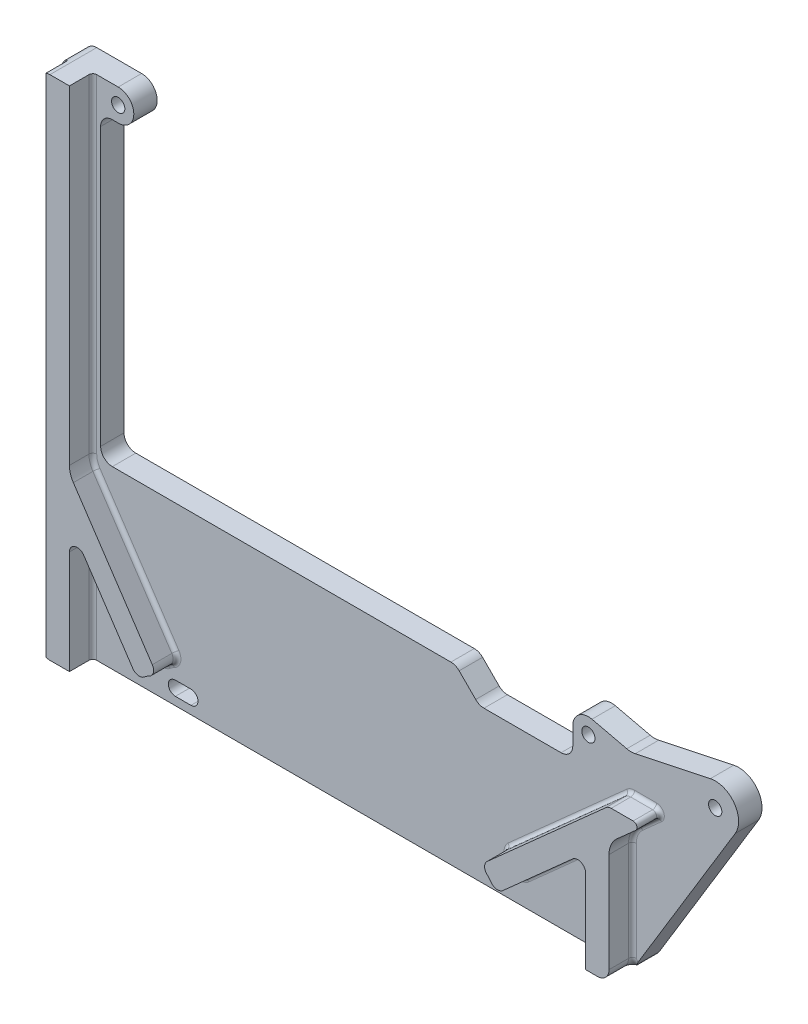
from build123d import *

# Parameters (mm, degrees)
SKETCH1_R           = 1.7
BOSS_EXTRUDE1_DEPTH = 6
BOSS_EXTRUDE2_START = 6
BOSS_EXTRUDE2_DEPTH = 6
SKETCH2_R           = 3.1
CUT_EXTRUDE1_DEPTH  = 3
FILLET1_R           = 2
FILLET2_R           = 6
FILLET3_R           = 1
FILLET4_R           = 1
FILLET5_DEPTH       = 6
FILLET5_START       = -1
FILLET5_3_DEPTH     = 13
FILLET5_START_2     = 6.9999999
FILLET5_4_DEPTH     = 5.0000001
FILLET5_5_DEPTH     = 6


with BuildPart() as part:
    # Sketch1 → Boss-Extrude1 (new body)
    with BuildSketch(Plane.XY):
        with BuildLine():
            Line((4, 0), (150.292108611, 0))
            Line((150.292108611, 0), (176.628985356, 43.386559906))
            ThreePointArc((176.628985356, 43.386559906), (176.393105018, 49.97239446), (170.254392606, 52.369281235))
            Line((170.254392606, 52.369281235), (151.015607145, 48.286332665))
            ThreePointArc((151.015607145, 48.286332665), (149.926554244, 48.177660945), (148.839947189, 48.308545892))
            Line((148.839947189, 48.308545892), (139.910123035, 50.395083576))
            ThreePointArc((139.910123035, 50.395083576), (136.514088914, 49.633727185), (135, 46.5))
            Line((135, 46.5), (135, 39))
            Line((135, 39), (111, 39))
            Line((111, 39), (105, 45))
            Line((105, 45), (14, 45))
            Line((14, 45), (14, 122))
            Line((14, 122), (18.5, 122))
            ThreePointArc((18.5, 122), (22.5, 126), (18.5, 130))
            Line((18.5, 130), (4, 130))
            Line((4, 130), (4, 0))
        make_face()
        with BuildLine():
            Line((33.15, 5.69), (37.15, 5.69))
            ThreePointArc((37.15, 5.69), (38.95, 3.89), (37.15, 2.09))
            Line((37.15, 2.09), (33.15, 2.09))
            ThreePointArc((33.15, 2.09), (31.35, 3.89), (33.15, 5.69))
        make_face(mode=Mode.SUBTRACT)
        with Locations((115.15, 3.89)):
            Circle(SKETCH1_R, mode=Mode.SUBTRACT)
        with Locations((171.5, 46.5)):
            Circle(SKETCH1_R, mode=Mode.SUBTRACT)
        with Locations((18.5, 126)):
            Circle(SKETCH1_R, mode=Mode.SUBTRACT)
        with Locations((139, 46.5)):
            Circle(SKETCH1_R, mode=Mode.SUBTRACT)
    extrude(amount=BOSS_EXTRUDE1_DEPTH)

    # Sketch1<3> → Boss-Extrude2 (add)
    with BuildSketch(Plane.XY.offset(BOSS_EXTRUDE2_START)):
        with BuildLine():
            Line((12, 33.156912913), (29.769570295, 6.545367431))
            ThreePointArc((29.769570295, 6.545367431), (31.818094908, 8.879830504), (34.759400799, 9.877272523))
            Line((34.759400799, 9.877272523), (12, 43.961542399))
            Line((12, 43.961542399), (12, 130))
            Line((12, 130), (6, 130))
            Line((6, 130), (6, 0))
            Line((6, 0), (12, 0))
            Line((12, 0), (12, 33.156912913))
        make_face()
        with BuildLine():
            ThreePointArc((117.028697802, 9.58828874), (119.626144393, 7.885513906), (121.024211708, 5.112144348))
            Line((121.024211708, 5.112144348), (144.292108611, 25.881627522))
            Line((144.292108611, 25.881627522), (144.292108611, 0))
            Line((144.292108611, 0), (150.292108611, 0))
            Line((150.292108611, 0), (150.292108611, 31.237371514))
            Line((150.292108611, 31.237371514), (159.087870064, 39.088679274))
            Line((159.087870064, 39.088679274), (150.077765021, 39.088679274))
            Line((150.077765021, 39.088679274), (117.028697802, 9.58828874))
        make_face()
    extrude(amount=BOSS_EXTRUDE2_DEPTH)

    # Sketch2 → Cut-Extrude1 (cut)
    with BuildSketch(Plane(origin=(0, 0, 0), x_dir=(-1, 0, 0), z_dir=(0, 0, -1))):
        with Locations((-139, 46.5)):
            Circle(SKETCH2_R)
    extrude(amount=-CUT_EXTRUDE1_DEPTH, mode=Mode.SUBTRACT)

    # Fillet1
    fillet1_edges = [part.edges().sort_by_distance(p)[0] for p in [
        (150.077765021, 39.088679274, 9),
        (117.028697802, 9.58828874, 9),
        (121.024211708, 5.112144348, 9),
        (144.292108611, 25.881627522, 9),
        (12, 33.156912913, 9),
        (29.769570295, 6.545367431, 9),
        (34.759400799, 9.877272523, 9),
    ]]
    fillet(fillet1_edges, radius=FILLET1_R)

    # Fillet2
    fillet2_edges = [part.edges().sort_by_distance(p)[0] for p in [
        (150.292108611, 31.237371514, 9),
        (12, 43.961542399, 9),
    ]]
    fillet(fillet2_edges, radius=FILLET2_R)

    # Fillet3
    fillet3_edges = [part.edges().sort_by_distance(p)[0] for p in [
        (159.087870064, 39.088679274, 9),
    ]]
    fillet(fillet3_edges, radius=FILLET3_R)

    # Fillet4
    fillet4_edges = [part.edges().sort_by_distance(p)[0] for p in [
        (150.292108611, 14.275239757, 6),
        (144.292108611, 10.70775043, 6),
        (31.818094908, 8.879830504, 6),
        (21.955332725, 18.24789794, 6),
        (132.014705022, 14.922522436, 6),
        (119.626144393, 7.885513906, 6),
        (134.291167915, 24.997183839, 6),
        (143.109520399, 23.24083315, 6),
        (13.419721476, 28.474156966, 6),
        (29.643487506, 7.953534135, 6),
        (33.507072774, 10.53340121, 6),
        (121.499193347, 6.443768461, 6),
        (118.405499352, 9.909610742, 6),
        (150.127840882, 38.957381532, 6),
        (23.123694308, 27.302799836, 6),
        (150.816111741, 31.002714877, 6),
        (12.258093391, 44.039791347, 6),
        (153.653220831, 39.088679274, 6),
        (154.714203524, 35.184639557, 6),
        (157.400244487, 38.445032985, 6),
        (12, 13.280094048, 6),
        (12, 87.89031346, 6),
        (6, 65, 6),
    ]]
    fillet(fillet4_edges, radius=FILLET4_R)

    # Fillet5: read off the stored shape, not the designer's step
    # Fillet5 outline → Fillet5 (add)
    with BuildSketch(Plane.XY):
        with BuildLine():
            ThreePointArc((135, 42), (134.121320344, 39.878679656), (132, 39))
            Line((132, 39), (135, 39))
            Line((135, 39), (135, 42))
        make_face()
        with BuildLine():
            ThreePointArc((112.242640687, 39), (111.09459039, 39.228361402), (110.121320344, 39.878679656))
            Line((110.121320344, 39.878679656), (111, 39))
            Line((111, 39), (112.242640687, 39))
        make_face()
    extrude(amount=FILLET5_DEPTH)

    # Fillet5 2 outline → Fillet5 2 (revolve, cut)
    with BuildSketch(Plane(origin=(151.292108611, 0, 7), x_dir=(1, 0, 0), z_dir=(0, 0, 1))):
        with BuildLine():
            ThreePointArc((4, 0), (1.878679656, 0.878679656), (1, 3))
            Line((1, 3), (1, 0))
            Line((1, 0), (4, 0))
        make_face()
    revolve(axis=Axis((151.292108611, 0, 7), (0, 1, 0)), mode=Mode.SUBTRACT)

    # Fillet5 3 outline → Fillet5 3 (cut)
    with BuildSketch(Plane.XY.offset(FILLET5_START)):
        with BuildLine():
            Line((150.292108611, 0), (151.168220622, 1.443279953))
            ThreePointArc((151.168220622, 1.443279953), (150.075094632, 0.385601394), (148.603727944, 0))
            Line((148.603727944, 0), (150.292108611, 0))
        make_face()
        with BuildLine():
            ThreePointArc((7, 0), (4.878679656, 0.878679656), (4, 3))
            Line((4, 3), (4, 0))
            Line((4, 0), (7, 0))
        make_face()
        with BuildLine():
            Line((7, 130), (4, 130))
            Line((4, 130), (4, 127))
            ThreePointArc((4, 127), (4.878679656, 129.121320344), (7, 130))
        make_face()
        with BuildLine():
            Line((105, 45), (103.757359313, 45))
            ThreePointArc((103.757359313, 45), (104.90540961, 44.771638598), (105.878679656, 44.121320344))
            Line((105.878679656, 44.121320344), (105, 45))
        make_face()
    extrude(amount=FILLET5_3_DEPTH, mode=Mode.SUBTRACT)

    # Fillet5 4 outline → Fillet5 4 (cut)
    with BuildSketch(Plane.XY.offset(FILLET5_START_2)):
        with BuildLine():
            ThreePointArc((148.603727944, 0), (149.487080244, 0.13300005), (150.292108611, 0.520207524))
            Line((150.292108611, 0.520207524), (150.292108611, 3))
            ThreePointArc((150.292108611, 3), (149.413428955, 0.878679656), (147.292108611, 0))
            Line((147.292108611, 0), (148.603727944, 0))
        make_face()
    extrude(amount=FILLET5_4_DEPTH, mode=Mode.SUBTRACT)

    # Fillet5 5 outline → Fillet5 5 (add)
    with BuildSketch(Plane.XY):
        with BuildLine():
            ThreePointArc((17, 45), (14.878679656, 45.878679656), (14, 48))
            Line((14, 48), (14, 45))
            Line((14, 45), (17, 45))
        make_face()
        with BuildLine():
            ThreePointArc((14, 119), (14.878679656, 121.121320344), (17, 122))
            Line((17, 122), (14, 122))
            Line((14, 122), (14, 119))
        make_face()
    extrude(amount=FILLET5_5_DEPTH)


solid = part.part
